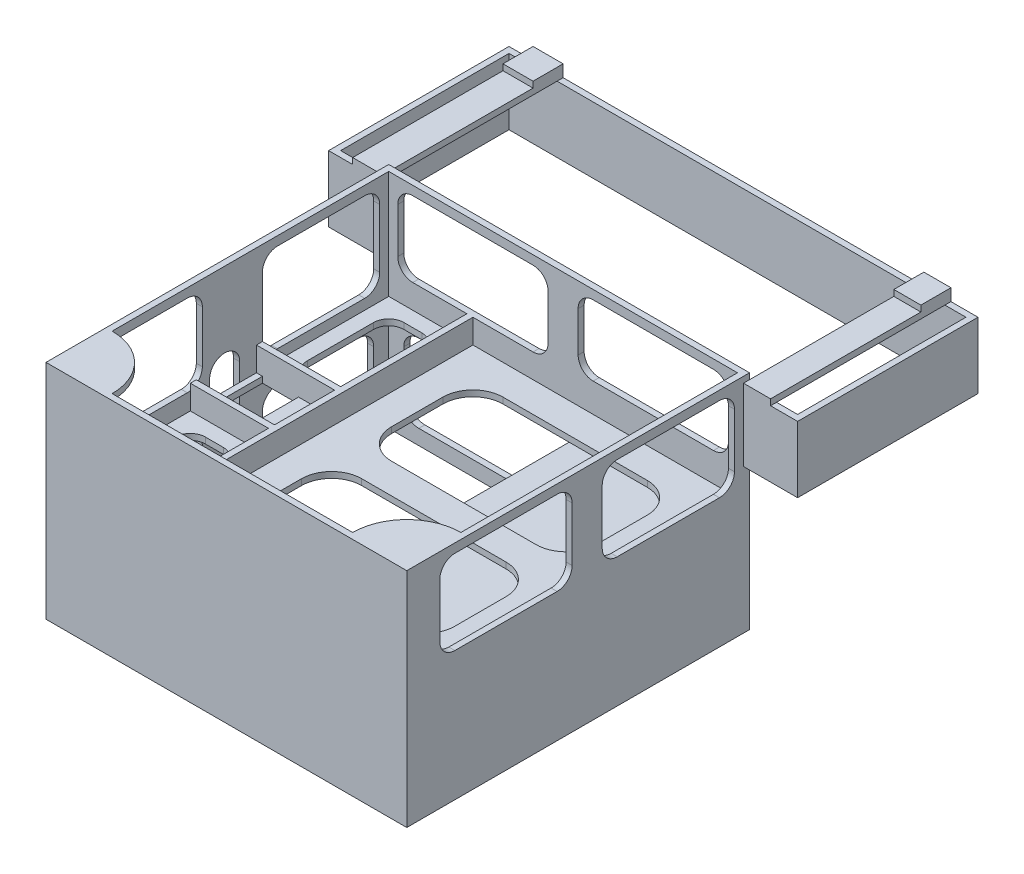
from build123d import *

# Parameters (mm, degrees)
SKETCH1_W                = 60
SKETCH1_H                = 54
BOSS_EXTRUDE1_DEPTH      = 38
SKETCH2_W                = 44
SKETCH2_H                = 52
CUT_EXTRUDE1_DEPTH       = 19
SKETCH3_W                = 35
SKETCH3_H                = 52
CUT_EXTRUDE2_DEPTH       = 18
SKETCH4_W                = 6
SKETCH4_H                = 10
CUT_EXTRUDE3_DEPTH       = 38
SKETCH5_W                = 14
SKETCH5_H                = 52
CUT_EXTRUDE5_DEPTH       = 15
SKETCH6_W                = 13
SKETCH6_H                = 52
CUT_EXTRUDE6_DEPTH       = 4
SKETCH8_W                = 14
SKETCH8_H                = 12.5
CUT_EXTRUDE7_DEPTH       = 6
SKETCH10_W               = 12.5
SKETCH10_H               = 5
CUT_EXTRUDE8_DEPTH       = 6
SKETCH11_W               = 4.5
SKETCH11_H               = 5
CUT_EXTRUDE9_DEPTH       = 3
SKETCH12_W               = 5
SKETCH12_H               = 2
CUT_EXTRUDE10_DEPTH      = 13
CUT_EXTRUDE11_DEPTH      = 1
SKETCH14_W               = 13
SKETCH14_H               = 1
BOSS_EXTRUDE2_DEPTH      = 4
SKETCH15_W               = 13
SKETCH15_H               = 1
BOSS_EXTRUDE3_DEPTH      = 4
CUT_EXTRUDE12_DEPTH      = 1
CUT_EXTRUDE13_DEPTH      = 1
CUT_EXTRUDE14_DEPTH      = 1
CUT_EXTRUDE15_DEPTH      = 60
CUT_EXTRUDE16_START      = -1
CUT_EXTRUDE16_DEPTH      = 1
CUT_EXTRUDE17_DEPTH      = 100
CUT_EXTRUDE17_DEPTH_BACK = 10
CUT_EXTRUDE18_DEPTH      = 10
SKETCH23_W               = 58
SKETCH23_H               = 52
BOSS_EXTRUDE4_DEPTH      = 1
SKETCH24_W               = 40
SKETCH24_H               = 10
SKETCH24_W_2             = 10
SKETCH24_H_2             = 34
CUT_EXTRUDE20_DEPTH      = 1
FILLET1_R                = 9
FILLET2_R                = 9
FILLET3_R                = 9
FILLET4_R                = 9
SKETCH27_W               = 10
SKETCH27_H               = 11
BOSS_EXTRUDE10_DEPTH     = 1
SKETCH31_W               = 1
SKETCH31_H               = 11
BOSS_EXTRUDE12_DEPTH     = 29
SKETCH33_W               = 1
SKETCH33_H               = 11
BOSS_EXTRUDE13_DEPTH     = 78
SKETCH34_W               = 5
SKETCH34_H               = 30
SKETCH34_W_2             = 4.5
BOSS_EXTRUDE14_DEPTH     = 1
SKETCH35_W               = 28
SKETCH35_H               = 11
BOSS_EXTRUDE15_DEPTH     = 1
SKETCH37_W               = 30
SKETCH37_H               = 11
CUT_EXTRUDE21_DEPTH      = 1
SKETCH38_W               = 28
SKETCH38_H               = 11
BOSS_EXTRUDE16_DEPTH     = 1
SKETCH39_W               = 30
SKETCH39_H               = 11
CUT_EXTRUDE22_DEPTH      = 1
SKETCH40_W               = 60
SKETCH40_H               = 37
BOSS_EXTRUDE17_DEPTH     = 3
SKETCH41_W               = 35
SKETCH41_H               = 18
CUT_EXTRUDE23_DEPTH      = 3
SKETCH42_W               = 44
SKETCH42_H               = 18
CUT_EXTRUDE24_DEPTH      = 3
SKETCH44_W               = 13
SKETCH44_H               = 18
CUT_EXTRUDE25_DEPTH      = 3
SKETCH45_W               = 3
SKETCH45_H               = 14
CUT_EXTRUDE26_DEPTH      = 3
SKETCH47_W               = 60
SKETCH47_H               = 10
CUT_EXTRUDE27_DEPTH      = 1
SKETCH48_W               = 60
SKETCH48_H               = 10
CUT_EXTRUDE28_DEPTH      = 1
SKETCH49_W               = 60
SKETCH49_H               = 10
BOSS_EXTRUDE18_DEPTH     = 1
SKETCH50_W               = 40
SKETCH50_H               = 9
CUT_EXTRUDE29_DEPTH      = 1
FILLET5_R                = 9
FILLET6_R                = 9
SKETCH51_W               = 5
SKETCH51_H               = 5
SKETCH51_W_2             = 4.5
BOSS_EXTRUDE19_DEPTH     = 1


with BuildPart() as part:
    # Sketch1 → Boss-Extrude1 (new body)
    with BuildSketch(Plane(origin=(0, 0, 0), x_dir=(1, 0, 0), z_dir=(0, 1, 0))):
        with Locations((-83.874465942, -33.946435202)):
            Rectangle(SKETCH1_W, SKETCH1_H)
    extrude(amount=BOSS_EXTRUDE1_DEPTH)

    # Sketch2 → Cut-Extrude1 (cut)
    with BuildSketch(Plane(origin=(0, 38, 0), x_dir=(1, 0, 0), z_dir=(0, 1, 0))):
        with Locations((-76.874465942, -33.946435202)):
            Rectangle(SKETCH2_W, SKETCH2_H)
    extrude(amount=-CUT_EXTRUDE1_DEPTH, mode=Mode.SUBTRACT)

    # Sketch3 → Cut-Extrude2 (cut)
    with BuildSketch(Plane(origin=(0, 0, 0), x_dir=(-1, 0, 0), z_dir=(0, -1, 0))):
        with Locations((95.374465942, -33.946435202)):
            Rectangle(SKETCH3_W, SKETCH3_H)
    extrude(amount=-CUT_EXTRUDE2_DEPTH, mode=Mode.SUBTRACT)

    # Sketch4 → Cut-Extrude3 (cut)
    with BuildSketch(Plane(origin=(0, 18, 0), x_dir=(-1, 0, 0), z_dir=(0, -1, 0))):
        with Locations((108.874465942, -34.946435202)):
            Rectangle(SKETCH4_W, SKETCH4_H)
    extrude(amount=-CUT_EXTRUDE3_DEPTH, mode=Mode.SUBTRACT)

    # Sketch5 → Cut-Extrude5 (cut)
    with BuildSketch(Plane(origin=(0, 38, 0), x_dir=(1, 0, 0), z_dir=(0, 1, 0))):
        with Locations((-105.874465942, -33.946435202)):
            Rectangle(SKETCH5_W, SKETCH5_H)
    extrude(amount=-CUT_EXTRUDE5_DEPTH, mode=Mode.SUBTRACT)

    # Sketch6 → Cut-Extrude6 (cut)
    with BuildSketch(Plane(origin=(0, 23, 0), x_dir=(1, 0, 0), z_dir=(0, 1, 0))):
        with Locations((-106.374465942, -33.946435202)):
            Rectangle(SKETCH6_W, SKETCH6_H)
    extrude(amount=-CUT_EXTRUDE6_DEPTH, mode=Mode.SUBTRACT)

    # Sketch8 → Cut-Extrude7 (cut)
    with BuildSketch(Plane(origin=(0, 0, 0), x_dir=(-1, 0, 0), z_dir=(0, -1, 0))):
        with Locations((65.374465942, -17.696435202)):
            Rectangle(SKETCH8_W, SKETCH8_H)
    extrude(amount=-CUT_EXTRUDE7_DEPTH, mode=Mode.SUBTRACT)

    # Sketch10 → Cut-Extrude8 (cut)
    with BuildSketch(Plane(origin=(-72.374465942, 0, 0), x_dir=(0, 0, -1), z_dir=(1, 0, 0))):
        with Locations((-17.696435202, 3.5)):
            Rectangle(SKETCH10_W, SKETCH10_H)
    extrude(amount=-CUT_EXTRUDE8_DEPTH, mode=Mode.SUBTRACT)

    # Sketch11 → Cut-Extrude9 (cut)
    with BuildSketch(Plane.XZ):
        with Locations((-66.124465942, 48.446435202)):
            Rectangle(SKETCH11_W, SKETCH11_H)
    extrude(amount=-CUT_EXTRUDE9_DEPTH, mode=Mode.SUBTRACT)

    # Sketch12 → Cut-Extrude10 (cut)
    with BuildSketch(Plane(origin=(-68.374465942, 0, 0), x_dir=(0, 0, -1), z_dir=(1, 0, 0))):
        with Locations((-48.446435202, 2)):
            Rectangle(SKETCH12_W, SKETCH12_H)
    extrude(amount=-CUT_EXTRUDE10_DEPTH, mode=Mode.SUBTRACT)

    # Sketch13 → Cut-Extrude11 (cut)
    with BuildSketch(Plane.ZY.offset(113.874465942)):
        with BuildLine():
            Line((32.733045904, 15), (32.733045904, 22))
            ThreePointArc((32.733045904, 22), (35.233045904, 24.5), (37.733045904, 22))
            Line((37.733045904, 22), (37.733045904, 15))
            ThreePointArc((37.733045904, 15), (35.233045904, 12.5), (32.733045904, 15))
        make_face()
    extrude(amount=-CUT_EXTRUDE11_DEPTH, mode=Mode.SUBTRACT)

    # Sketch14 → Boss-Extrude2 (add)
    with BuildSketch(Plane(origin=(0, 19, 0), x_dir=(1, 0, 0), z_dir=(0, 1, 0))):
        with Locations((-106.374465942, -40.446435202)):
            Rectangle(SKETCH14_W, SKETCH14_H)
    extrude(amount=BOSS_EXTRUDE2_DEPTH)

    # Sketch15 → Boss-Extrude3 (add)
    with BuildSketch(Plane(origin=(0, 19, 0), x_dir=(1, 0, 0), z_dir=(0, 1, 0))):
        with Locations((-106.374465942, -29.446435202)):
            Rectangle(SKETCH15_W, SKETCH15_H)
    extrude(amount=BOSS_EXTRUDE3_DEPTH)

    # Sketch16 → Cut-Extrude12 (cut)
    with BuildSketch(Plane(origin=(0, 19, 0), x_dir=(1, 0, 0), z_dir=(0, 1, 0))):
        with BuildLine():
            Line((-64.874465942, -54.946435202), (-88.874465942, -54.946435202))
            ThreePointArc((-88.874465942, -54.946435202), (-92.409999848, -53.481969108), (-93.874465942, -49.946435202))
            Line((-93.874465942, -49.946435202), (-93.874465942, -41.446435202))
            ThreePointArc((-93.874465942, -41.446435202), (-92.409999848, -37.910901296), (-88.874465942, -36.446435202))
            Line((-88.874465942, -36.446435202), (-64.874465942, -36.446435202))
            ThreePointArc((-64.874465942, -36.446435202), (-61.338932037, -37.910901296), (-59.874465942, -41.446435202))
            Line((-59.874465942, -41.446435202), (-59.874465942, -49.946435202))
            ThreePointArc((-59.874465942, -49.946435202), (-61.338932037, -53.481969108), (-64.874465942, -54.946435202))
        make_face()
        with BuildLine():
            Line((-88.874465942, -31.446435202), (-64.874465942, -31.446435202))
            ThreePointArc((-64.874465942, -31.446435202), (-61.338932037, -29.981969108), (-59.874465942, -26.446435202))
            Line((-59.874465942, -26.446435202), (-59.874465942, -17.946435202))
            ThreePointArc((-59.874465942, -17.946435202), (-61.338932037, -14.410901296), (-64.874465942, -12.946435202))
            Line((-64.874465942, -12.946435202), (-88.874465942, -12.946435202))
            ThreePointArc((-88.874465942, -12.946435202), (-92.409999848, -14.410901296), (-93.874465942, -17.946435202))
            Line((-93.874465942, -17.946435202), (-93.874465942, -26.446435202))
            ThreePointArc((-93.874465942, -26.446435202), (-92.409999848, -29.981969108), (-88.874465942, -31.446435202))
        make_face()
    extrude(amount=-CUT_EXTRUDE12_DEPTH, mode=Mode.SUBTRACT)

    # Sketch17 → Cut-Extrude13 (cut)
    with BuildSketch(Plane(origin=(0, 19, 0), x_dir=(1, 0, 0), z_dir=(0, 1, 0))):
        with BuildLine():
            Line((-104.874465942, -57.446435202), (-107.874465942, -57.446435202))
            ThreePointArc((-107.874465942, -57.446435202), (-109.642232895, -56.714202155), (-110.374465942, -54.946435202))
            Line((-110.374465942, -54.946435202), (-110.374465942, -45.946435202))
            ThreePointArc((-110.374465942, -45.946435202), (-109.642232895, -44.178668249), (-107.874465942, -43.446435202))
            Line((-107.874465942, -43.446435202), (-104.874465942, -43.446435202))
            ThreePointArc((-104.874465942, -43.446435202), (-103.10669899, -44.178668249), (-102.374465942, -45.946435202))
            Line((-102.374465942, -45.946435202), (-102.374465942, -54.946435202))
            ThreePointArc((-102.374465942, -54.946435202), (-103.10669899, -56.714202155), (-104.874465942, -57.446435202))
        make_face()
        with BuildLine():
            Line((-104.874465942, -26.446435202), (-107.874465942, -26.446435202))
            ThreePointArc((-107.874465942, -26.446435202), (-109.642232895, -25.714202155), (-110.374465942, -23.946435202))
            Line((-110.374465942, -23.946435202), (-110.374465942, -12.946435202))
            ThreePointArc((-110.374465942, -12.946435202), (-109.642232895, -11.178668249), (-107.874465942, -10.446435202))
            Line((-107.874465942, -10.446435202), (-104.874465942, -10.446435202))
            ThreePointArc((-104.874465942, -10.446435202), (-103.10669899, -11.178668249), (-102.374465942, -12.946435202))
            Line((-102.374465942, -12.946435202), (-102.374465942, -23.946435202))
            ThreePointArc((-102.374465942, -23.946435202), (-103.10669899, -25.714202155), (-104.874465942, -26.446435202))
        make_face()
    extrude(amount=-CUT_EXTRUDE13_DEPTH, mode=Mode.SUBTRACT)

    # Sketch18 → Cut-Extrude14 (cut)
    with BuildSketch(Plane(origin=(-53.874465942, 0, 0), x_dir=(0, 0, -1), z_dir=(1, 0, 0))):
        with BuildLine():
            Line((-55.946435202, 35.5), (-38.946435202, 35.5))
            ThreePointArc((-38.946435202, 35.5), (-37.178668249, 34.767766953), (-36.446435202, 33))
            Line((-36.446435202, 33), (-36.446435202, 24))
            ThreePointArc((-36.446435202, 24), (-37.178668249, 22.232233047), (-38.946435202, 21.5))
            Line((-38.946435202, 21.5), (-55.946435202, 21.5))
            ThreePointArc((-55.946435202, 21.5), (-57.714202155, 22.232233047), (-58.446435202, 24))
            Line((-58.446435202, 24), (-58.446435202, 33))
            ThreePointArc((-58.446435202, 33), (-57.714202155, 34.767766953), (-55.946435202, 35.5))
        make_face()
        with BuildLine():
            Line((-28.946435202, 35.5), (-11.946435202, 35.5))
            ThreePointArc((-11.946435202, 35.5), (-10.178668249, 34.767766953), (-9.446435202, 33))
            Line((-9.446435202, 33), (-9.446435202, 24))
            ThreePointArc((-9.446435202, 24), (-10.178668249, 22.232233047), (-11.946435202, 21.5))
            Line((-11.946435202, 21.5), (-28.946435202, 21.5))
            ThreePointArc((-28.946435202, 21.5), (-30.714202155, 22.232233047), (-31.446435202, 24))
            Line((-31.446435202, 24), (-31.446435202, 33))
            ThreePointArc((-31.446435202, 33), (-30.714202155, 34.767766953), (-28.946435202, 35.5))
        make_face()
    extrude(amount=-CUT_EXTRUDE14_DEPTH, mode=Mode.SUBTRACT)

    # Sketch19 → Cut-Extrude15 (cut)
    with BuildSketch(Plane(origin=(0, 0, 6.946435202), x_dir=(-1, 0, 0), z_dir=(0, 0, -1))):
        with BuildLine():
            Line((58.874465942, 35.5), (78.874465942, 35.5))
            ThreePointArc((78.874465942, 35.5), (80.642232895, 34.767766953), (81.374465942, 33))
            Line((81.374465942, 33), (81.374465942, 26.304053451))
            ThreePointArc((81.374465942, 26.304053451), (80.642232895, 24.536286498), (78.874465942, 23.804053451))
            Line((78.874465942, 23.804053451), (58.874465942, 23.804053451))
            ThreePointArc((58.874465942, 23.804053451), (57.10669899, 24.536286498), (56.374465942, 26.304053451))
            Line((56.374465942, 26.304053451), (56.374465942, 33))
            ThreePointArc((56.374465942, 33), (57.10669899, 34.767766953), (58.874465942, 35.5))
        make_face()
        with BuildLine():
            Line((88.874465942, 35.5), (108.874465942, 35.5))
            ThreePointArc((108.874465942, 35.5), (110.642232895, 34.767766953), (111.374465942, 33))
            Line((111.374465942, 33), (111.374465942, 25.5))
            ThreePointArc((111.374465942, 25.5), (110.642232895, 23.732233047), (108.874465942, 23))
            Line((108.874465942, 23), (88.874465942, 23))
            ThreePointArc((88.874465942, 23), (87.10669899, 23.732233047), (86.374465942, 25.5))
            Line((86.374465942, 25.5), (86.374465942, 33))
            ThreePointArc((86.374465942, 33), (87.10669899, 34.767766953), (88.874465942, 35.5))
        make_face()
    extrude(amount=-CUT_EXTRUDE15_DEPTH, mode=Mode.SUBTRACT)

    # Sketch20 → Cut-Extrude16 (cut)
    with BuildSketch(Plane.ZY.offset(113.874465942).offset(CUT_EXTRUDE16_START)):
        with BuildLine():
            Line((11.946435202, 35.5), (26.446435202, 35.5))
            ThreePointArc((26.446435202, 35.5), (28.214202155, 34.767766953), (28.946435202, 33))
            Line((28.946435202, 33), (28.946435202, 23.221982389))
            ThreePointArc((28.946435202, 23.221982389), (28.214202155, 21.454215436), (26.446435202, 20.721982389))
            Line((26.446435202, 20.721982389), (11.946435202, 20.721982389))
            ThreePointArc((11.946435202, 20.721982389), (10.178668249, 21.454215436), (9.446435202, 23.221982389))
            Line((9.446435202, 23.221982389), (9.446435202, 33))
            ThreePointArc((9.446435202, 33), (10.178668249, 34.767766953), (11.946435202, 35.5))
        make_face()
        with BuildLine():
            Line((41.446435202, 35.5), (55.946435202, 35.5))
            ThreePointArc((55.946435202, 35.5), (57.714202155, 34.767766953), (58.446435202, 33))
            Line((58.446435202, 33), (58.446435202, 24.375603128))
            ThreePointArc((58.446435202, 24.375603128), (57.714202155, 22.607836175), (55.946435202, 21.875603128))
            Line((55.946435202, 21.875603128), (41.446435202, 21.875603128))
            ThreePointArc((41.446435202, 21.875603128), (39.678668249, 22.607836175), (38.946435202, 24.375603128))
            Line((38.946435202, 24.375603128), (38.946435202, 33))
            ThreePointArc((38.946435202, 33), (39.678668249, 34.767766953), (41.446435202, 35.5))
        make_face()
    extrude(amount=CUT_EXTRUDE16_DEPTH, mode=Mode.SUBTRACT)

    # Sketch21 → Cut-Extrude17 (cut, two sides: drawn at the far end of the back side and taken through both)
    with BuildSketch(Plane(origin=(0, 0, 59.946435202), x_dir=(-1, 0, 0), z_dir=(0, 0, -1)).offset(-CUT_EXTRUDE17_DEPTH_BACK)):
        with BuildLine():
            Line((107.874465942, 2.5), (82.874465942, 2.5))
            ThreePointArc((82.874465942, 2.5), (81.10669899, 3.232233047), (80.374465942, 5))
            Line((80.374465942, 5), (80.374465942, 13))
            ThreePointArc((80.374465942, 13), (81.10669899, 14.767766953), (82.874465942, 15.5))
            Line((82.874465942, 15.5), (107.874465942, 15.5))
            ThreePointArc((107.874465942, 15.5), (109.642232895, 14.767766953), (110.374465942, 13))
            Line((110.374465942, 13), (110.374465942, 5))
            ThreePointArc((110.374465942, 5), (109.642232895, 3.232233047), (107.874465942, 2.5))
        make_face()
    extrude(amount=CUT_EXTRUDE17_DEPTH + CUT_EXTRUDE17_DEPTH_BACK, mode=Mode.SUBTRACT)

    # Sketch22 → Cut-Extrude18 (cut)
    with BuildSketch(Plane(origin=(-112.874465942, 0, 0), x_dir=(0, 0, -1), z_dir=(1, 0, 0))):
        with BuildLine():
            Line((-12.946435202, 2.5), (-26.446435202, 2.5))
            ThreePointArc((-26.446435202, 2.5), (-28.214202155, 3.232233047), (-28.946435202, 5))
            Line((-28.946435202, 5), (-28.946435202, 13))
            ThreePointArc((-28.946435202, 13), (-28.214202155, 14.767766953), (-26.446435202, 15.5))
            Line((-26.446435202, 15.5), (-12.946435202, 15.5))
            ThreePointArc((-12.946435202, 15.5), (-11.178668249, 14.767766953), (-10.446435202, 13))
            Line((-10.446435202, 13), (-10.446435202, 5))
            ThreePointArc((-10.446435202, 5), (-11.178668249, 3.232233047), (-12.946435202, 2.5))
        make_face()
        with BuildLine():
            Line((-41.446435202, 2.5), (-54.946435202, 2.5))
            ThreePointArc((-54.946435202, 2.5), (-56.714202155, 3.232233047), (-57.446435202, 5))
            Line((-57.446435202, 5), (-57.446435202, 13))
            ThreePointArc((-57.446435202, 13), (-56.714202155, 14.767766953), (-54.946435202, 15.5))
            Line((-54.946435202, 15.5), (-41.446435202, 15.5))
            ThreePointArc((-41.446435202, 15.5), (-39.678668249, 14.767766953), (-38.946435202, 13))
            Line((-38.946435202, 13), (-38.946435202, 5))
            ThreePointArc((-38.946435202, 5), (-39.678668249, 3.232233047), (-41.446435202, 2.5))
        make_face()
    extrude(amount=-CUT_EXTRUDE18_DEPTH, mode=Mode.SUBTRACT)

    # Sketch23 → Boss-Extrude4 (add)
    with BuildSketch(Plane(origin=(0, 38, 0), x_dir=(1, 0, 0), z_dir=(0, 1, 0))):
        with Locations((-83.874465942, -33.946435202)):
            Rectangle(SKETCH23_W, SKETCH23_H)
    extrude(amount=-BOSS_EXTRUDE4_DEPTH)

    # Sketch24 → Cut-Extrude20 (cut)
    with BuildSketch(Plane(origin=(0, 38, 0), x_dir=(1, 0, 0), z_dir=(0, 1, 0))):
        with Locations((-83.874465942, -55.946435202)):
            Rectangle(SKETCH24_W, SKETCH24_H)
        with Locations((-58.874465942, -33.946435202)):
            Rectangle(SKETCH24_W_2, SKETCH24_H_2)
        with Locations((-83.874465942, -11.946435202)):
            Rectangle(SKETCH24_W, SKETCH24_H)
        with Locations((-83.874465942, -33.946435202)):
            Rectangle(SKETCH24_W, SKETCH24_H_2)
        with Locations((-108.874465942, -33.946435202)):
            Rectangle(SKETCH24_W_2, SKETCH24_H_2)
    extrude(amount=-CUT_EXTRUDE20_DEPTH, mode=Mode.SUBTRACT)

    # Fillet1
    fillet1_edges = [part.edges().sort_by_distance(p)[0] for p in [
        (-103.874465942, 37.5, 50.946435202),
    ]]
    fillet(fillet1_edges, radius=FILLET1_R)

    # Fillet2
    fillet2_edges = [part.edges().sort_by_distance(p)[0] for p in [
        (-63.874465942, 37.5, 16.946435202),
    ]]
    fillet(fillet2_edges, radius=FILLET2_R)

    # Fillet3
    fillet3_edges = [part.edges().sort_by_distance(p)[0] for p in [
        (-63.874465942, 37.5, 50.946435202),
    ]]
    fillet(fillet3_edges, radius=FILLET3_R)

    # Fillet4
    fillet4_edges = [part.edges().sort_by_distance(p)[0] for p in [
        (-103.874465942, 37.5, 16.946435202),
    ]]
    fillet(fillet4_edges, radius=FILLET4_R)

    # Sketch27 → Boss-Extrude10 (add)
    with BuildSketch(Plane(origin=(0, 0, 6.946435202), x_dir=(-1, 0, 0), z_dir=(0, 0, -1))):
        with Locations((48.874465942, 29.5)):
            Rectangle(SKETCH27_W, SKETCH27_H)
        with Locations((118.874465942, 29.5)):
            Rectangle(SKETCH27_W, SKETCH27_H)
    extrude(amount=-BOSS_EXTRUDE10_DEPTH)

    # Sketch31 → Boss-Extrude12 (add)
    with BuildSketch(Plane(origin=(0, 0, 6.946435202), x_dir=(-1, 0, 0), z_dir=(0, 0, -1))):
        with Locations((44.374465942, 29.5)):
            Rectangle(SKETCH31_W, SKETCH31_H)
        with Locations((123.374465942, 29.5)):
            Rectangle(SKETCH31_W, SKETCH31_H)
    extrude(amount=BOSS_EXTRUDE12_DEPTH)

    # Sketch33 → Boss-Extrude13 (add)
    with BuildSketch(Plane.ZY.offset(44.874465942)):
        with Locations((-21.553564798, 29.5)):
            Rectangle(SKETCH33_W, SKETCH33_H)
    extrude(amount=BOSS_EXTRUDE13_DEPTH)

    # Sketch34 → Boss-Extrude14 (add)
    with BuildSketch(Plane(origin=(0, 35, 0), x_dir=(1, 0, 0), z_dir=(0, 1, 0))):
        with Locations((-116.374465942, 7.053564798)):
            Rectangle(SKETCH34_W, SKETCH34_H)
        with Locations((-51.624465942, 7.053564798)):
            Rectangle(SKETCH34_W_2, SKETCH34_H)
    extrude(amount=BOSS_EXTRUDE14_DEPTH)

    # Sketch35 → Boss-Extrude15 (add)
    with BuildSketch(Plane(origin=(-122.874465942, 0, 0), x_dir=(0, 0, -1), z_dir=(1, 0, 0))):
        with Locations((7.053564798, 29.5)):
            Rectangle(SKETCH35_W, SKETCH35_H)
    extrude(amount=BOSS_EXTRUDE15_DEPTH)

    # Sketch37 → Cut-Extrude21 (cut)
    with BuildSketch(Plane.ZY.offset(123.874465942)):
        with Locations((-7.053564798, 29.5)):
            Rectangle(SKETCH37_W, SKETCH37_H)
    extrude(amount=-CUT_EXTRUDE21_DEPTH, mode=Mode.SUBTRACT)

    # Sketch38 → Boss-Extrude16 (add)
    with BuildSketch(Plane.ZY.offset(44.874465942)):
        with Locations((-7.053564798, 29.5)):
            Rectangle(SKETCH38_W, SKETCH38_H)
    extrude(amount=BOSS_EXTRUDE16_DEPTH)

    # Sketch39 → Cut-Extrude22 (cut)
    with BuildSketch(Plane(origin=(-43.874465942, 0, 0), x_dir=(0, 0, -1), z_dir=(1, 0, 0))):
        with Locations((7.053564798, 29.5)):
            Rectangle(SKETCH39_W, SKETCH39_H)
    extrude(amount=-CUT_EXTRUDE22_DEPTH, mode=Mode.SUBTRACT)

    # Sketch40 → Boss-Extrude17 (add)
    with BuildSketch(Plane.XY.offset(60.946435202)):
        with Locations((-83.874465942, 18.5)):
            Rectangle(SKETCH40_W, SKETCH40_H)
    extrude(amount=BOSS_EXTRUDE17_DEPTH)

    # Sketch41 → Cut-Extrude23 (cut)
    with BuildSketch(Plane(origin=(0, 0, 59.946435202), x_dir=(-1, 0, 0), z_dir=(0, 0, -1))):
        with Locations((95.374465942, 9)):
            Rectangle(SKETCH41_W, SKETCH41_H)
    extrude(amount=-CUT_EXTRUDE23_DEPTH, mode=Mode.SUBTRACT)

    # Sketch42 → Cut-Extrude24 (cut)
    with BuildSketch(Plane(origin=(0, 0, 59.946435202), x_dir=(-1, 0, 0), z_dir=(0, 0, -1))):
        with Locations((76.874465942, 28)):
            Rectangle(SKETCH42_W, SKETCH42_H)
    extrude(amount=-CUT_EXTRUDE24_DEPTH, mode=Mode.SUBTRACT)

    # Sketch44 → Cut-Extrude25 (cut)
    with BuildSketch(Plane(origin=(0, 0, 59.946435202), x_dir=(-1, 0, 0), z_dir=(0, 0, -1))):
        with Locations((106.374465942, 28)):
            Rectangle(SKETCH44_W, SKETCH44_H)
    extrude(amount=-CUT_EXTRUDE25_DEPTH, mode=Mode.SUBTRACT)

    # Sketch45 → Cut-Extrude26 (cut)
    with BuildSketch(Plane(origin=(-98.874465942, 0, 0), x_dir=(0, 0, -1), z_dir=(1, 0, 0))):
        with Locations((-61.446435202, 30)):
            Rectangle(SKETCH45_W, SKETCH45_H)
    extrude(amount=-CUT_EXTRUDE26_DEPTH, mode=Mode.SUBTRACT)

    # Sketch47 → Cut-Extrude27 (cut)
    with BuildSketch(Plane(origin=(0, 38, 0), x_dir=(1, 0, 0), z_dir=(0, 1, 0))):
        with Locations((-83.874465942, -11.946435202)):
            Rectangle(SKETCH47_W, SKETCH47_H)
    extrude(amount=-CUT_EXTRUDE27_DEPTH, mode=Mode.SUBTRACT)

    # Sketch48 → Cut-Extrude28 (cut)
    with BuildSketch(Plane(origin=(0, 38, 0), x_dir=(1, 0, 0), z_dir=(0, 1, 0))):
        with Locations((-83.874465942, -55.946435202)):
            Rectangle(SKETCH48_W, SKETCH48_H)
    extrude(amount=-CUT_EXTRUDE28_DEPTH, mode=Mode.SUBTRACT)

    # Sketch49 → Boss-Extrude18 (add)
    with BuildSketch(Plane(origin=(0, 37, 0), x_dir=(1, 0, 0), z_dir=(0, 1, 0))):
        with Locations((-83.874465942, -58.946435202)):
            Rectangle(SKETCH49_W, SKETCH49_H)
    extrude(amount=-BOSS_EXTRUDE18_DEPTH)

    # Sketch50 → Cut-Extrude29 (cut)
    with BuildSketch(Plane(origin=(0, 37, 0), x_dir=(1, 0, 0), z_dir=(0, 1, 0))):
        with Locations((-83.874465942, -58.446435202)):
            Rectangle(SKETCH50_W, SKETCH50_H)
    extrude(amount=-CUT_EXTRUDE29_DEPTH, mode=Mode.SUBTRACT)

    # Fillet5
    fillet5_edges = [part.edges().sort_by_distance(p)[0] for p in [
        (-103.874465942, 36.5, 53.946435202),
    ]]
    fillet(fillet5_edges, radius=FILLET5_R - 0.0001)  # a hair under: the kernel refuses the full size

    # Fillet6
    fillet6_edges = [part.edges().sort_by_distance(p)[0] for p in [
        (-63.874465942, 36.5, 53.946435202),
    ]]
    fillet(fillet6_edges, radius=FILLET6_R - 0.0001)  # a hair under: the kernel refuses the full size

    # Sketch51 → Boss-Extrude19 (add)
    with BuildSketch(Plane(origin=(0, 36, 0), x_dir=(1, 0, 0), z_dir=(0, 1, 0))):
        with Locations((-116.374465942, 19.553564798)):
            Rectangle(SKETCH51_W, SKETCH51_H)
        with Locations((-51.624465942, 19.553564798)):
            Rectangle(SKETCH51_W_2, SKETCH51_H)
    extrude(amount=BOSS_EXTRUDE19_DEPTH)


solid = part.part
